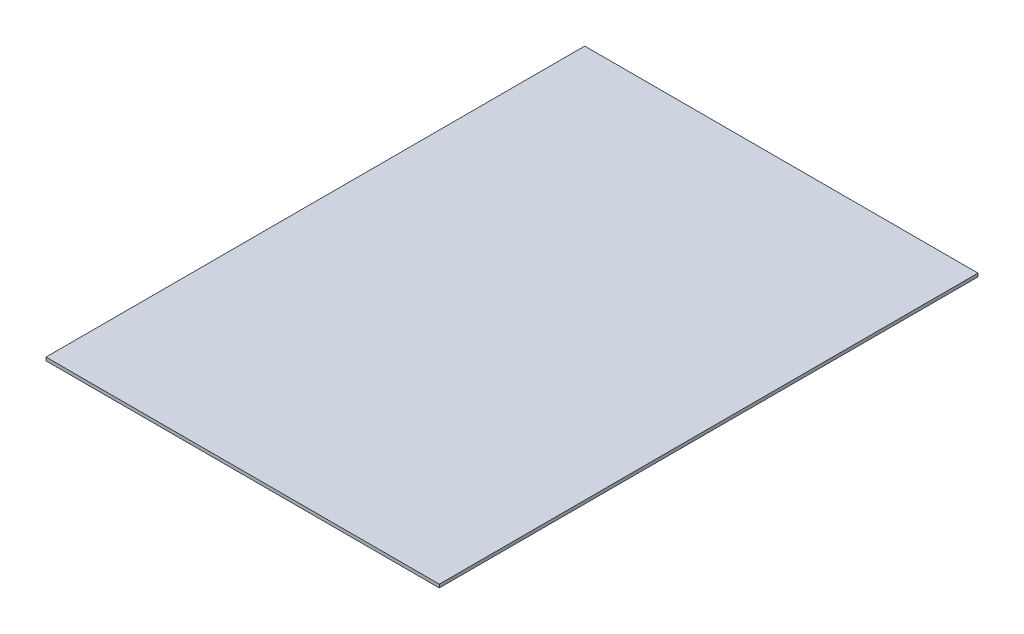
from build123d import *

# Parameters (mm, degrees)
SKETCH1_W           = 60
SKETCH1_H           = 82.18
BOSS_EXTRUDE1_DEPTH = 0.5


with BuildPart() as part:
    # Sketch1 → Boss-Extrude1 (new body)
    with BuildSketch(Plane(origin=(0, 0, 0), x_dir=(1, 0, 0), z_dir=(0, 1, 0))):
        Rectangle(SKETCH1_W, SKETCH1_H)
    extrude(amount=BOSS_EXTRUDE1_DEPTH)


solid = part.part
